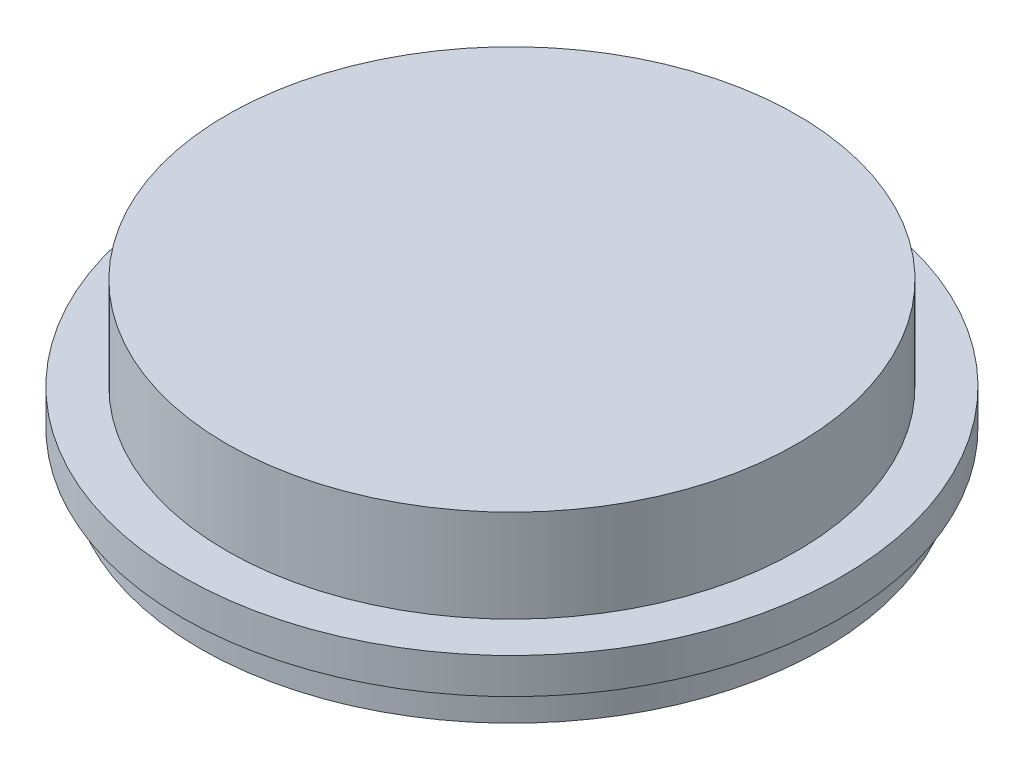
from build123d import *


with BuildPart() as part:
    # Sketch1 → Revolve1 (revolve)
    with BuildSketch(Plane.XY):
        Polygon((58.7375, -6.35), (58.7375, 0), (50.8, 0), (50.8, 16.51), (0, 16.51), (0, 10.16), (44.45, 10.16), (44.45, -6.35), (49.2125, -6.35), (49.2125, -12.7), (55.5625, -12.7), (55.5625, -6.35), align=None)
    revolve(axis=Axis((0, 3.81, 0), (0, -1, 0)))


solid = part.part
